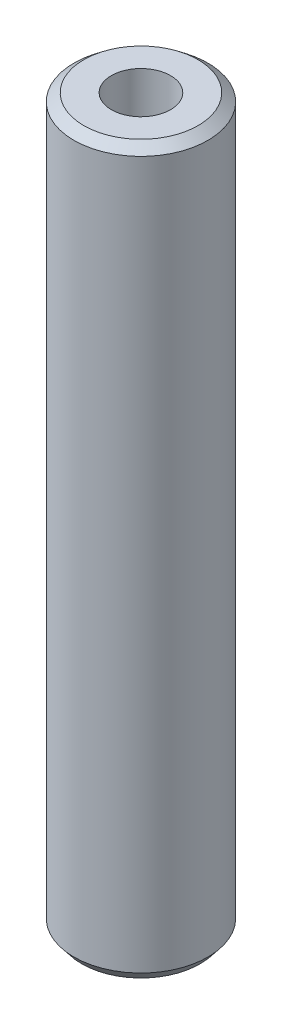
from build123d import *
from OCP.BRepFilletAPI import BRepFilletAPI_MakeChamfer

# Parameters (mm, degrees)
SKETCH1_R           = 17.5
BOSS_EXTRUDE1_DEPTH = 189.383427414
SKETCH2_R           = 7.728203797
CUT_EXTRUDE1_DEPTH  = 191.993671568
CHAMFER1_SIZE       = 2.04821663
CHAMFER1_SIZE2      = 2.573856002


with BuildPart() as part:
    # Sketch1 → Boss-Extrude1 (new body)
    with BuildSketch(Plane(origin=(0, 0, 0), x_dir=(1, 0, 0), z_dir=(0, 1, 0))):
        Circle(SKETCH1_R)
    extrude(amount=BOSS_EXTRUDE1_DEPTH)

    # Sketch2 → Cut-Extrude1 (cut, through all)
    with BuildSketch(Plane(origin=(0, 0, 0), x_dir=(1, 0, 0), z_dir=(0, 1, 0))):
        Circle(SKETCH2_R)
    extrude(amount=CUT_EXTRUDE1_DEPTH, mode=Mode.SUBTRACT)

    # Chamfer1: one chamfer whose edges measure the first distance from different faces: ONE call of the kernel's chamfer builder (chamfer() names one face for all edges)
    chamfer1_edges_1 = [part.edges().sort_by_distance(p)[0] for p in [
        (-17.5, 189.383427414, 0),
    ]]
    chamfer1_side_1 = [part.faces().sort_by_distance(p)[0] for p in [
        (-17.5, 94.691713707, 0),
    ]]
    chamfer1_edges_2 = [part.edges().sort_by_distance(p)[0] for p in [
        (-17.5, 0, 0),
    ]]
    chamfer1_side_2 = [part.faces().sort_by_distance(p)[0] for p in [
        (-17.005025253, 0, 0),
    ]]
    chamfer1 = BRepFilletAPI_MakeChamfer(part.part.solid().wrapped)
    for e in chamfer1_edges_1:
        chamfer1.Add(CHAMFER1_SIZE, CHAMFER1_SIZE2, e.wrapped, chamfer1_side_1[0].wrapped)  # the first distance lies on this face
    for e in chamfer1_edges_2:
        chamfer1.Add(CHAMFER1_SIZE, CHAMFER1_SIZE2, e.wrapped, chamfer1_side_2[0].wrapped)  # the first distance lies on this face
    add(Compound.cast(chamfer1.Shape()), mode=Mode.REPLACE)


solid = part.part
